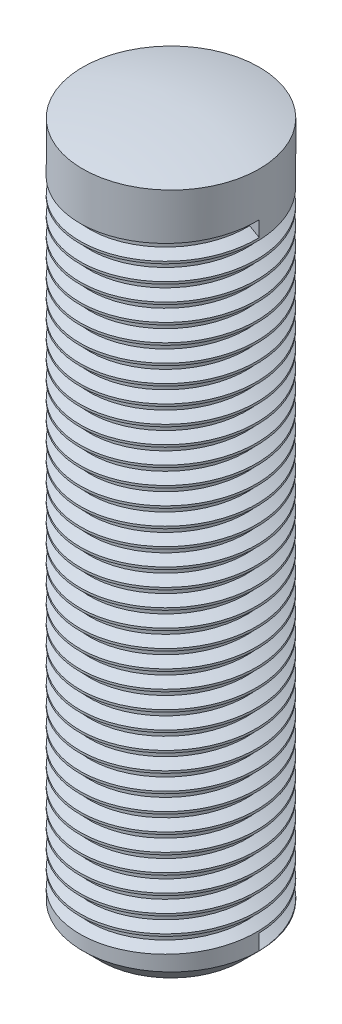
from build123d import *

# Parameters (mm, degrees)
CHAMFER_1_SIZE = 1
THREAD_1_PITCH = 1


with BuildPart() as part:
    # Sketch 1 → 旋转1 (revolve)
    with BuildSketch(Plane.XY, mode=Mode.PRIVATE) as revolve_1_sk:
        with BuildLine():
            Line((0, -12.65625), (0, 27.34375))
            ThreePointArc((0, 27.34375), (2.52008585, 27.184343925), (5, 26.708666731))
            Line((5, 26.708666731), (5, -12.65625))
            Line((5, -12.65625), (0, -12.65625))
        make_face()
    revolve(revolve_1_sk.sketch.rotate(Axis((0, -12.65625, 0), (0, 1, 0)), 90), axis=Axis((0, -12.65625, 0), (0, 1, 0)))

    # 倒角1
    chamfer_1_edges = [part.edges().sort_by_distance(p)[0] for p in [
        (0, -12.65625, 5),
    ]]
    chamfer(chamfer_1_edges, length=CHAMFER_1_SIZE)

    # 螺纹线1: the profile of Sketch 1 2 profile screwed along a right-hand helix of 35 turns, 8 arcs to a turn; built about Z, then put on its axis
    thread_1_z = Axis((0, 0, 0), (0, 0, 1))
    thread_1_corners = [(5.0003, 0, -0.000173205), (5.0003, 0, 0.875173202), (4.458734125, 0, 0.562499999), (4.458734125, 0, 0.312499999)]
    with BuildLine(mode=Mode.PRIVATE) as thread_1_profile:
        Line(thread_1_corners[0], thread_1_corners[1])
        Line(thread_1_corners[1], thread_1_corners[2])
        Line(thread_1_corners[2], thread_1_corners[3])
        Line(thread_1_corners[3], thread_1_corners[0])
    thread_1_cap = Face(thread_1_profile.wire())
    thread_1_turn_angles = [0, 22.5, 45, 67.5, 90, 112.5, 135, 157.5, 180, 202.5, 225, 247.5, 270, 292.5, 315, 337.5, 360]
    thread_1_turn_weights = [1, 0.9238795325112867, 1, 0.9238795325112867, 1, 0.9238795325112867, 1, 0.9238795325112867, 1, 0.9238795325112867, 1, 0.9238795325112867, 1, 0.9238795325112867, 1, 0.9238795325112867, 1]
    thread_1_turn_rails = [Edge.make_bspline([Vector(p[0], p[1], 0).rotate(thread_1_z, thread_1_turn_angles[k]) / thread_1_turn_weights[k] + Vector(0, 0, p[2] + THREAD_1_PITCH * thread_1_turn_angles[k] / 360) for k in range(17)], [0, 0, 0, 1, 1, 2, 2, 3, 3, 4, 4, 5, 5, 6, 6, 7, 7, 8, 8, 8], 2, thread_1_turn_weights) for p in thread_1_corners]
    thread_1_turn_sides = [Face.make_surface_from_curves(thread_1_turn_rails[p[0]], thread_1_turn_rails[p[1]]) for p in [(0, 1), (1, 2), (2, 3), (3, 0)]]
    thread_1 = Plane(origin=(0, -11.65625, 0), x_dir=(1, 0, 0), z_dir=(0, 1, 0)) * Solid(Shell([*[p.moved(Location((0, 0, THREAD_1_PITCH * i))) for i in range(35) for p in thread_1_turn_sides], thread_1_cap, thread_1_cap.rotate(thread_1_z, 12600).moved(Location((0, 0, THREAD_1_PITCH * 12600 / 360)))]))
    add(thread_1, mode=Mode.SUBTRACT)


solid = part.part
